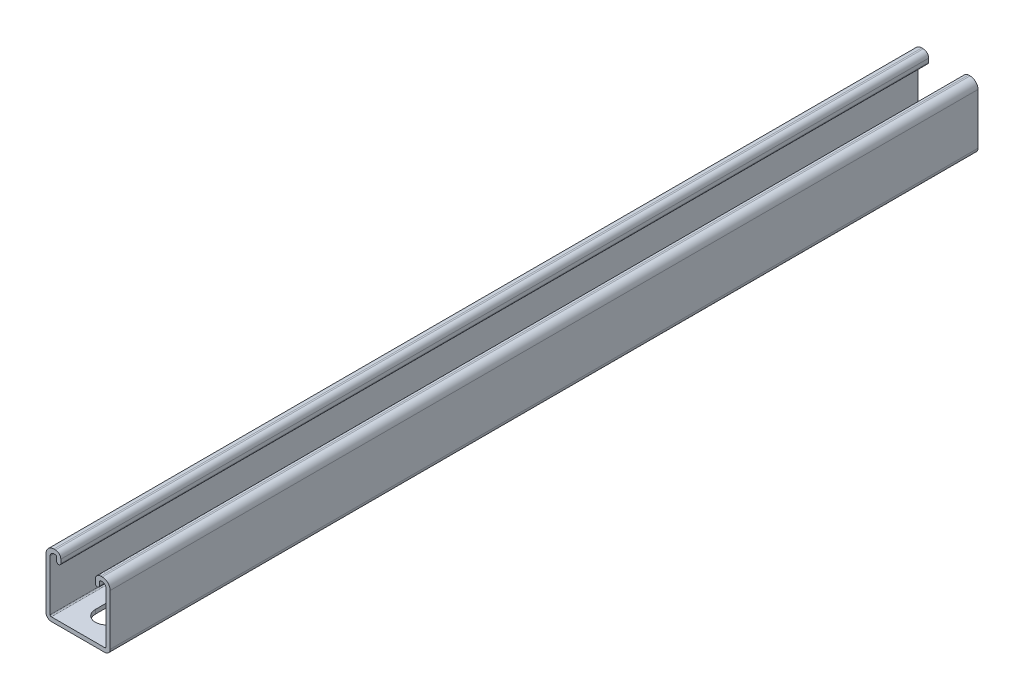
from build123d import *

# Parameters (mm, degrees)
PRIMARY_EXTRUSION_DEPTH = 558.8
SLOT_CUT_REACH          = 562.702
LPATTERN1_COUNT         = 11
LPATTERN1_PITCH         = 50.8


with BuildPart() as part:
    # Sketch1 → Primary Extrusion (new body)
    with BuildSketch(Plane.XY):
        with BuildLine():
            Line((17.176891111, -17.970376528), (-17.176891111, -17.970376528))
            ThreePointArc((-17.176891111, -17.970376528), (-17.738157147, -17.737892523), (-17.970641152, -17.176626487))
            Line((-17.970641152, -17.176626487), (-17.970641152, 15.589126408))
            ThreePointArc((-17.970641152, 15.589126408), (-17.273189139, 17.272924515), (-15.589391032, 17.970376528))
            Line((-15.589391032, 17.970376528), (-14.57342631, 17.970376528))
            ThreePointArc((-14.57342631, 17.970376528), (-14.012171972, 17.737897369), (-13.779692813, 17.176643031))
            Line((-13.779692813, 17.176643031), (-13.779692813, 14.833457753))
            ThreePointArc((-13.779692813, 14.833457753), (-12.446175174, 13.499940114), (-11.112657535, 14.833457753))
            Line((-11.112657535, 14.833457753), (-11.112657535, 17.176643031))
            ThreePointArc((-11.112657535, 17.176643031), (-12.126293241, 19.623776099), (-14.57342631, 20.637411806))
            Line((-14.57342631, 20.637411806), (-15.589391032, 20.637411806))
            ThreePointArc((-15.589391032, 20.637411806), (-19.15906787, 19.158803246), (-20.637676429, 15.589126408))
            Line((-20.637676429, 15.589126408), (-20.637676429, -17.176626487))
            ThreePointArc((-20.637676429, -17.176626487), (-19.624035878, -19.623771254), (-17.176891111, -20.637411806))
            Line((-17.176891111, -20.637411806), (17.176891111, -20.637411806))
            ThreePointArc((17.176891111, -20.637411806), (19.624035878, -19.623771254), (20.637676429, -17.176626487))
            Line((20.637676429, -17.176626487), (20.637676429, 15.589126408))
            ThreePointArc((20.637676429, 15.589126408), (19.15906787, 19.158803246), (15.589391032, 20.637411806))
            Line((15.589391032, 20.637411806), (14.57342631, 20.637411806))
            ThreePointArc((14.57342631, 20.637411806), (12.126293241, 19.623776099), (11.112657535, 17.176643031))
            Line((11.112657535, 17.176643031), (11.112657535, 14.833457753))
            ThreePointArc((11.112657535, 14.833457753), (12.446175174, 13.499940114), (13.779692813, 14.833457753))
            Line((13.779692813, 14.833457753), (13.779692813, 17.176643031))
            ThreePointArc((13.779692813, 17.176643031), (14.012171972, 17.737897369), (14.57342631, 17.970376528))
            Line((14.57342631, 17.970376528), (15.589391032, 17.970376528))
            ThreePointArc((15.589391032, 17.970376528), (17.273189139, 17.272924515), (17.970641152, 15.589126408))
            Line((17.970641152, 15.589126408), (17.970641152, -17.176626487))
            ThreePointArc((17.970641152, -17.176626487), (17.738157147, -17.737892523), (17.176891111, -17.970376528))
        make_face()
    extrude(amount=-PRIMARY_EXTRUSION_DEPTH)

    # Sketch58 → Slot Cut (cut, up to next)
    with BuildSketch(Plane(origin=(0, -20.637411806, 0), x_dir=(-1, 0, 0), z_dir=(0, 1, 0)), mode=Mode.PRIVATE) as slot_cut_sk1:
        with BuildLine():
            Line((7.14375, -32.54375), (7.14375, -18.25625))
            ThreePointArc((7.14375, -18.25625), (0, -11.1125), (-7.14375, -18.25625))
            Line((-7.14375, -18.25625), (-7.14375, -32.54375))
            ThreePointArc((-7.14375, -32.54375), (0, -39.6875), (7.14375, -32.54375))
        make_face()
    slot_cut_tool1 = extrude(slot_cut_sk1.sketch, amount=SLOT_CUT_REACH, mode=Mode.PRIVATE) & part.part
    slot_cut = slot_cut_tool1.solids().sort_by_distance((0, -20.637412, -25.4))[0]
    add(slot_cut, mode=Mode.SUBTRACT)

    # LPattern1: Slot Cut ×11
    with Locations(*[(0, 0, -i * LPATTERN1_PITCH) for i in range(1, LPATTERN1_COUNT)]):
        add(slot_cut, mode=Mode.SUBTRACT)


solid = part.part
